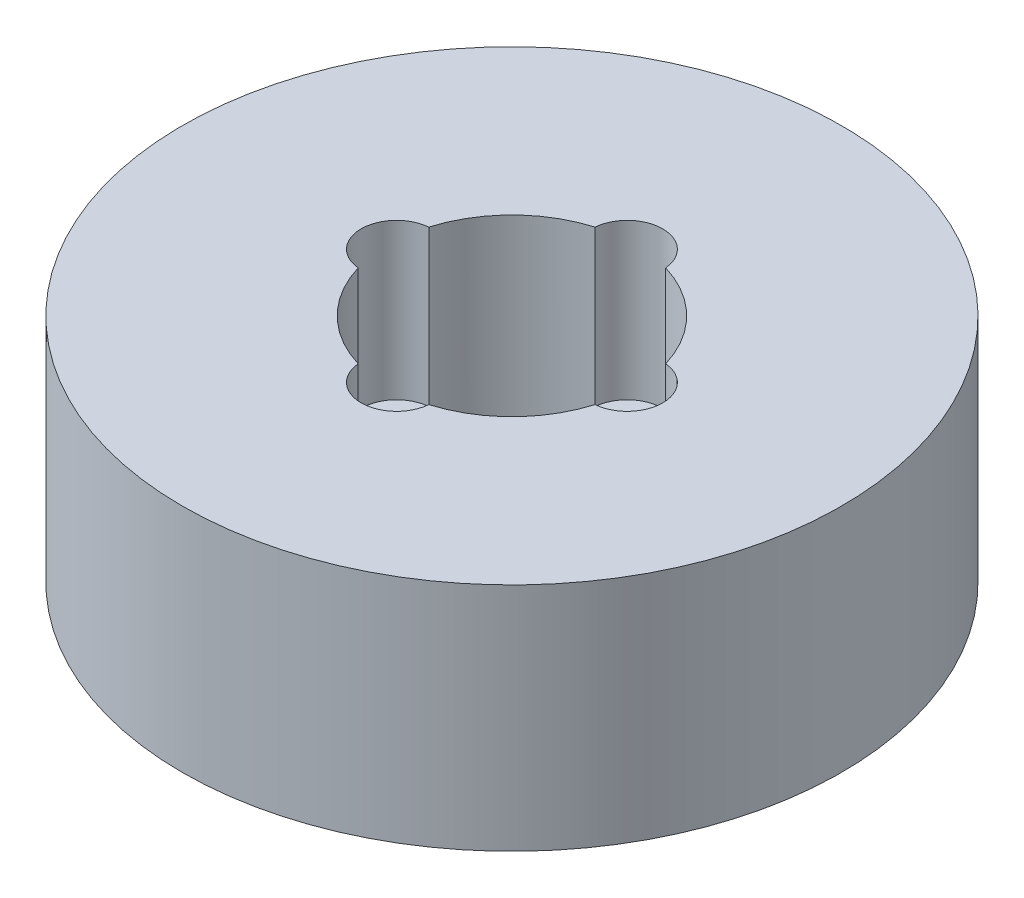
from build123d import *

# Parameters (mm, degrees)
SKETCH1_R           = 20
BOSS_EXTRUDE1_DEPTH = 14
SKETCH2_R           = 7.5
CUT_EXTRUDE1_DEPTH  = 32.559467676
SKETCH3_R           = 2.151795717
CUT_EXTRUDE2_DEPTH  = 9.431459675
CIRPATTERN1_COUNT   = 4


with BuildPart() as part:
    # Sketch1 → Boss-Extrude1 (new body)
    with BuildSketch(Plane(origin=(0, 0, 0), x_dir=(1, 0, 0), z_dir=(0, 1, 0))):
        Circle(SKETCH1_R)
    extrude(amount=BOSS_EXTRUDE1_DEPTH)

    # Sketch2 → Cut-Extrude1 (cut, through all)
    with BuildSketch(Plane(origin=(0, 0, 0), x_dir=(1, 0, 0), z_dir=(0, 1, 0))):
        Circle(SKETCH2_R)
    extrude(amount=CUT_EXTRUDE1_DEPTH, mode=Mode.SUBTRACT)

    # Sketch3 → Cut-Extrude2 (cut)
    with BuildSketch(Plane(origin=(0, 14, 0), x_dir=(1, 0, 0), z_dir=(0, 1, 0))):
        with Locations((-6.99809627, 0)):
            Circle(SKETCH3_R)
    cut_extrude2 = extrude(amount=-CUT_EXTRUDE2_DEPTH, mode=Mode.SUBTRACT)

    # CirPattern1: Cut-Extrude2 ×4 about axis
    cirpattern1_axis = Axis((0, 0, 0), (0, 1, 0))
    for i in range(1, CIRPATTERN1_COUNT):
        add(cut_extrude2.rotate(cirpattern1_axis, i * 360 / CIRPATTERN1_COUNT), mode=Mode.SUBTRACT)


solid = part.part
